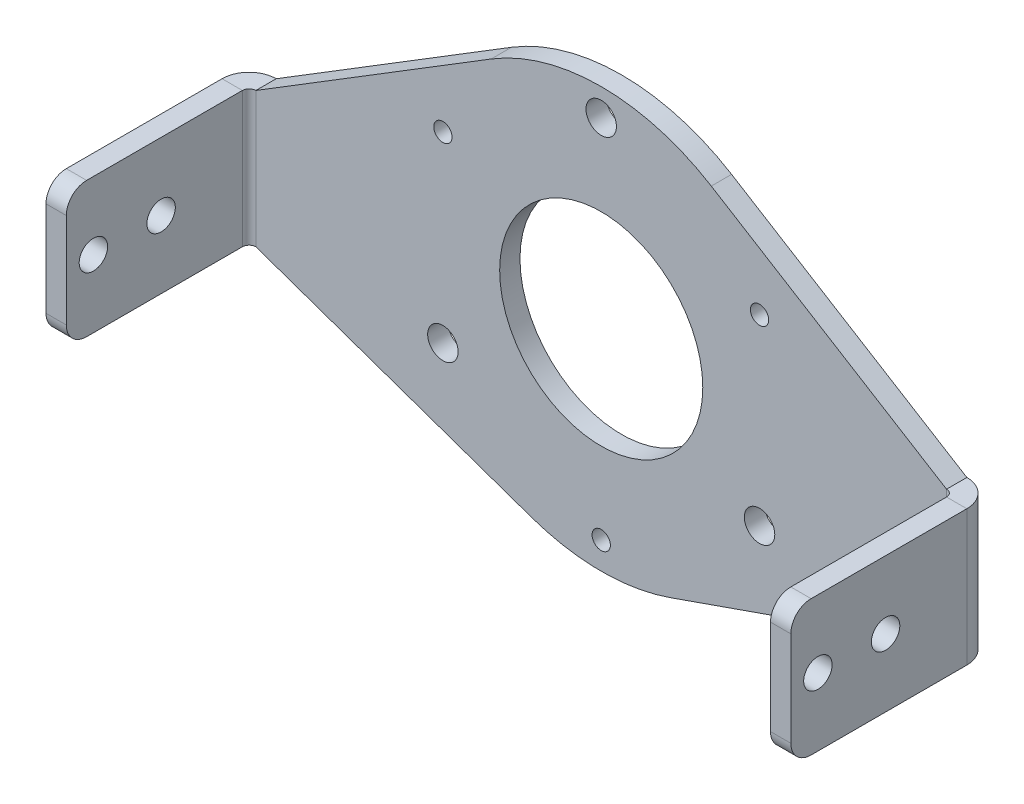
from build123d import *

# Parameters (mm, degrees)
SKETCH_1_R                  = 31
SKETCH_1_R_2                = 2.25
SKETCH_1_R_3                = 1.35
EXTRUDE_1_DEPTH             = 3
EXTRUDE_START               = -3
EXTRUDE_2_DEPTH             = 3
SKETCH_7_R                  = 15
CUT_EXTRUDE_1_DEPTH         = 3
SM_EDGE_FLANGE_1_DEPTH      = 20
SM_EDGE_FLANGE_1_BEND_DEPTH = 20
SKETCH_14_R                 = 2.1
CUT_EXTRUDE_2_DEPTH         = 119.156675647
FILLET_1_R                  = 3


# Sheet-metal steps are written as plain solids
with BuildPart() as part:
    # Sketch 1 → 凸台-拉伸1 (new body)
    with BuildSketch(Plane.XY):
        Circle(SKETCH_1_R)
        with Locations((0, 27)):
            Circle(SKETCH_1_R_2, mode=Mode.SUBTRACT)
        with Locations((0, -27)):
            Circle(SKETCH_1_R_3, mode=Mode.SUBTRACT)
        with Locations((23.382685902, -13.5)):
            Circle(SKETCH_1_R_2, mode=Mode.SUBTRACT)
        with Locations((-23.382685902, 13.5)):
            Circle(SKETCH_1_R_3, mode=Mode.SUBTRACT)
        with Locations((-23.382685902, -13.5)):
            Circle(SKETCH_1_R_2, mode=Mode.SUBTRACT)
        with Locations((23.382685902, 13.5)):
            Circle(SKETCH_1_R_3, mode=Mode.SUBTRACT)
    extrude(amount=EXTRUDE_1_DEPTH)

    # Sketch 2 → 凸台-拉伸2 (add)
    with BuildSketch(Plane.XY.offset(3).offset(EXTRUDE_START)):
        with BuildLine():
            ThreePointArc((-10.236969115, -29.260971674), (-30.820342362, -3.332641094), (-16.255261315, 26.396334586))
            Line((-16.255261315, 26.396334586), (-51, 5))
            Line((-51, 5), (-51, -15))
            Line((-51, -15), (-10.236969115, -29.260971674))
        make_face()
        with BuildLine():
            Line((51, -15), (51, 5))
            Line((51, 5), (16.255261315, 26.396334586))
            ThreePointArc((16.255261315, 26.396334586), (27.063934496, 15.117653575), (31, 0))
            ThreePointArc((31, 0), (25.281871396, -17.939536747), (10.236969115, -29.260971674))
            Line((10.236969115, -29.260971674), (51, -15))
        make_face()
    extrude(amount=EXTRUDE_2_DEPTH)

    # 草图7 → 切除-拉伸1 (cut)
    with BuildSketch(Plane.XY.offset(3)):
        Circle(SKETCH_7_R)
    extrude(amount=-CUT_EXTRUDE_1_DEPTH, mode=Mode.SUBTRACT)

    # 边线-法兰1 section (across the edge) → 边线-法兰1 (add)
    with BuildSketch(Plane(origin=(-52, 5, 3), x_dir=(1, 0, 0), z_dir=(0, -1, 0))):
        with BuildLine():
            Line((-3, 1), (-3, 27))
            Line((-3, 27), (0, 27))
            Line((0, 27), (0, 1))
            ThreePointArc((0, 1), (0.292893219, 0.292893219), (1, 0))
            Line((1, 0), (1, -3))
            ThreePointArc((1, -3), (-1.828427125, -1.828427125), (-3, 1))
        make_face()
    extrude(amount=SM_EDGE_FLANGE_1_DEPTH)

    # 边线-法兰1 section 2 (across the edge) → 边线-法兰1 bend (add)
    with BuildSketch(Plane(origin=(52, -15, 3), x_dir=(-1, 0, 0), z_dir=(0, 1, 0))):
        with BuildLine():
            Line((-3, 1), (-3, 27))
            Line((-3, 27), (0, 27))
            Line((0, 27), (0, 1))
            ThreePointArc((0, 1), (0.292893219, 0.292893219), (1, 0))
            Line((1, 0), (1, -3))
            ThreePointArc((1, -3), (-1.828427125, -1.828427125), (-3, 1))
        make_face()
    extrude(amount=SM_EDGE_FLANGE_1_BEND_DEPTH)

    # 草图14 → 切除-拉伸2 (cut, through all)
    with BuildSketch(Plane(origin=(55, 0, 0), x_dir=(0, 0, -1), z_dir=(1, 0, 0))):
        with Locations((-16, -5)):
            Circle(SKETCH_14_R)
        with Locations((-26, -5)):
            Circle(SKETCH_14_R)
    extrude(amount=-CUT_EXTRUDE_2_DEPTH, mode=Mode.SUBTRACT)

    # 圆角1
    fillet_1_edges = [part.edges().sort_by_distance(p)[0] for p in [
        (-53.5, 5, 30),
        (-53.5, -15, 30),
        (53.5, -15, 30),
        (53.5, 5, 30),
    ]]
    fillet(fillet_1_edges, radius=FILLET_1_R)


solid = part.part
